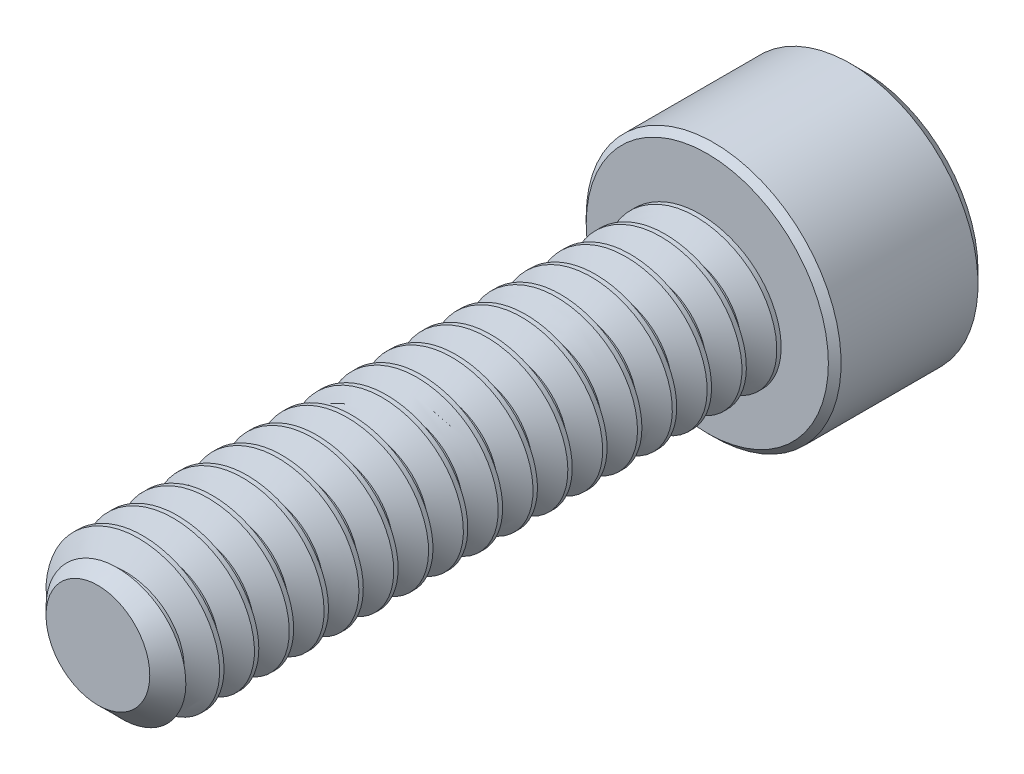
from build123d import *

# Parameters (mm, degrees)
SKETCH1_R          = 1.4224
EXTRUDE1_DEPTH     = 11.1125
CHAMFER3_SIZE      = 0.47625
CUT_SWEEP1_PITCH   = 0.635
SKETCH6_R          = 2.3241
EXTRUDE2_DEPTH     = 2.8448
CUT_EXTRUDE1_DEPTH = 1.7859375
CHAMFER1_SIZE      = 0.23241
CHAMFER2_SIZE      = 0.116205


with BuildPart() as part:
    # Sketch1 → Extrude1 (new body)
    with BuildSketch(Plane.XY):
        Circle(SKETCH1_R)
    extrude(amount=-EXTRUDE1_DEPTH)

    # Chamfer3
    chamfer3_edges = [part.edges().sort_by_distance(p)[0] for p in [
        (-1.4224, 0, 0),
    ]]
    chamfer(chamfer3_edges, length=CHAMFER3_SIZE)

    # Cut-Sweep1: the profile of Sketch3 profile screwed along a right-hand helix of 18.5 turns, 6 arcs to a turn; built about Z, then put on its axis
    cut_sweep1_z = Axis((0, 0, 0), (0, 0, 1))
    cut_sweep1_corners = [(1.4227, 0, -0.555798205), (1.009955401, 0, -0.3175), (1.009955401, 0, -0.238125), (1.4227, 0, 0.000173205)]
    with BuildLine(mode=Mode.PRIVATE) as cut_sweep1_profile:
        Line(cut_sweep1_corners[0], cut_sweep1_corners[1])
        Line(cut_sweep1_corners[1], cut_sweep1_corners[2])
        Line(cut_sweep1_corners[2], cut_sweep1_corners[3])
        Line(cut_sweep1_corners[3], cut_sweep1_corners[0])
    cut_sweep1_cap = Face(cut_sweep1_profile.wire())
    cut_sweep1_turn_angles = [0, 30, 60, 90, 120, 150, 180, 210, 240, 270, 300, 330, 360]
    cut_sweep1_turn_weights = [1, 0.8660254037844387, 1, 0.8660254037844387, 1, 0.8660254037844387, 1, 0.8660254037844387, 1, 0.8660254037844387, 1, 0.8660254037844387, 1]
    cut_sweep1_turn_rails = [Edge.make_bspline([Vector(p[0], p[1], 0).rotate(cut_sweep1_z, cut_sweep1_turn_angles[k]) / cut_sweep1_turn_weights[k] + Vector(0, 0, p[2] + CUT_SWEEP1_PITCH * cut_sweep1_turn_angles[k] / 360) for k in range(13)], [0, 0, 0, 1, 1, 2, 2, 3, 3, 4, 4, 5, 5, 6, 6, 6], 2, cut_sweep1_turn_weights) for p in cut_sweep1_corners]
    cut_sweep1_turn_sides = [Face.make_surface_from_curves(cut_sweep1_turn_rails[p[0]], cut_sweep1_turn_rails[p[1]]) for p in [(0, 1), (1, 2), (2, 3), (3, 0)]]
    cut_sweep1_last_angles = [6480, 6510, 6540, 6570, 6600, 6630, 6660]
    cut_sweep1_last_weights = [1, 0.8660254037844387, 1, 0.8660254037844387, 1, 0.8660254037843553, 1]
    cut_sweep1_last_rails = [Edge.make_bspline([Vector(p[0], p[1], 0).rotate(cut_sweep1_z, cut_sweep1_last_angles[k]) / cut_sweep1_last_weights[k] + Vector(0, 0, p[2] + CUT_SWEEP1_PITCH * cut_sweep1_last_angles[k] / 360) for k in range(7)], [0, 0, 0, 1, 1, 2, 2, 3, 3, 3], 2, cut_sweep1_last_weights) for p in cut_sweep1_corners]
    cut_sweep1_last_sides = [Face.make_surface_from_curves(cut_sweep1_last_rails[p[0]], cut_sweep1_last_rails[p[1]]) for p in [(0, 1), (1, 2), (2, 3), (3, 0)]]
    cut_sweep1 = Plane(origin=(0, 0, 0), x_dir=(0, 1, 0), z_dir=(0, 0, -1)) * Solid(Shell([*[p.moved(Location((0, 0, CUT_SWEEP1_PITCH * i))) for i in range(18) for p in cut_sweep1_turn_sides], *cut_sweep1_last_sides, cut_sweep1_cap, cut_sweep1_cap.rotate(cut_sweep1_z, 6660).moved(Location((0, 0, CUT_SWEEP1_PITCH * 6660 / 360)))]))
    add(cut_sweep1, mode=Mode.SUBTRACT)

    # Sketch6 → Extrude2 (add)
    with BuildSketch(Plane(origin=(0, 0, -11.1125), x_dir=(-1, 0, 0), z_dir=(0, 0, -1))):
        Circle(SKETCH6_R)
    extrude(amount=EXTRUDE2_DEPTH)

    # Sketch7 → Cut-Extrude1 (cut)
    with BuildSketch(Plane(origin=(0, 0, -13.9573), x_dir=(-1, 0, 0), z_dir=(0, 0, -1))):
        Polygon((0, 1.374815329), (-1.190625, 0.687407664), (-1.190625, -0.687407664), (0, -1.374815329), (1.190625, -0.687407664), (1.190625, 0.687407664), align=None)
    extrude(amount=-CUT_EXTRUDE1_DEPTH, mode=Mode.SUBTRACT)

    # Cut-Extrude2 cone 1 section (through the dimple's axis) → Cut-Extrude2 (revolve, cut)
    with BuildSketch(Plane(origin=(0, 0, -13.9573), x_dir=(0, 1, 0), z_dir=(1, 0, 0))):
        Polygon((0, 0), (1.374815329, 0), (0, 1.374815329), align=None)
    revolve(axis=Axis((0, 0, -13.9573), (0, 0, 1)), mode=Mode.SUBTRACT)

    # Chamfer1
    chamfer1_edges = [part.edges().sort_by_distance(p)[0] for p in [
        (2.3241, 0, -13.9573),
    ]]
    chamfer(chamfer1_edges, length=CHAMFER1_SIZE)

    # Chamfer2
    chamfer2_edges = [part.edges().sort_by_distance(p)[0] for p in [
        (2.3241, 0, -11.1125),
    ]]
    chamfer(chamfer2_edges, length=CHAMFER2_SIZE)


solid = part.part
